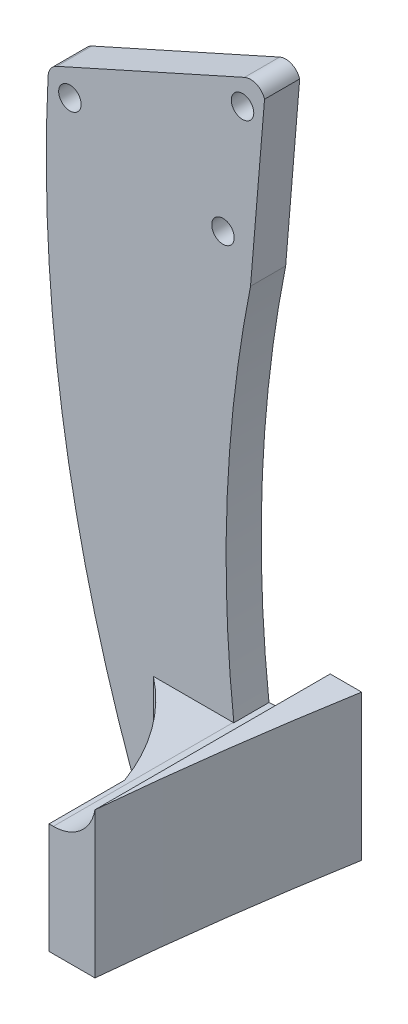
from build123d import *

# Parameters (mm, degrees)
SKETCH3_R                = 1.6
BOSS_EXTRUDE2_DEPTH      = 5
SKETCH8_W                = 6.531662429
SKETCH8_H                = 15.718756423
BOSS_EXTRUDE5_DEPTH      = 25.594989388
BOSS_EXTRUDE6_DEPTH      = 5
BOSS_EXTRUDE6_DEPTH_BACK = 15.725319597
BOSS_EXTRUDE7_DEPTH      = 15.715206985
FILLET3_R                = 6


with BuildPart() as part:
    # Sketch3 → Boss-Extrude2 (new body)
    with BuildSketch(Plane.XY):
        with BuildLine():
            Line((15.398328751, 23.358235096), (42.103650237, 35.3480109))
            ThreePointArc((42.103650237, 35.3480109), (43.812929052, 35.351800988), (44.957199874, 34.082040099))
            Line((44.957199874, 34.082040099), (42.962535727, 10.043789437))
            ThreePointArc((42.962535727, 10.043789437), (39.652134692, -17.353336053), (40.589325164, -44.933816726))
            Line((40.589325164, -44.933816726), (46.4215305, -44.933816726))
            Line((46.4215305, -44.933816726), (46.4215305, -60.652573149))
            Line((46.4215305, -60.652573149), (28.574574678, -60.652573149))
            ThreePointArc((28.574574678, -60.652573149), (27.026794649, -59.729266605), (26.047291344, -58.216424488))
            ThreePointArc((26.047291344, -58.216424488), (16.153529465, -18.922365583), (14.162802755, 21.549187347))
            ThreePointArc((14.162802755, 21.549187347), (14.525551977, 22.627878073), (15.398328751, 23.358235096))
        make_face()
        with Locations((17.26515434, 20.395199458)):
            Circle(SKETCH3_R, mode=Mode.SUBTRACT)
        with Locations((41.82515434, 31.625199458)):
            Circle(SKETCH3_R, mode=Mode.SUBTRACT)
        with Locations((39.04515434, 14.855199458)):
            Circle(SKETCH3_R, mode=Mode.SUBTRACT)
    extrude(amount=BOSS_EXTRUDE2_DEPTH)

    # Sketch8 → Boss-Extrude5 (add)
    with BuildSketch(Plane.XY.offset(5)):
        with Locations((43.155699286, -52.793194938)):
            Rectangle(SKETCH8_W, SKETCH8_H)
    extrude(amount=BOSS_EXTRUDE5_DEPTH)

    # Sketch9 → Boss-Extrude6 (add, two sides: drawn at the far end of the back side and taken through both)
    with BuildSketch(Plane(origin=(0, -44.933816726, 0), x_dir=(1, 0, 0), z_dir=(0, 1, 0)).offset(-BOSS_EXTRUDE6_DEPTH_BACK)):
        with BuildLine():
            Line((46.4215305, -30.594989388), (46.4215305, 0))
            Line((46.4215305, 0), (46.4215305, 2.879605598))
            Line((46.4215305, 2.879605598), (50.894134372, 2.879605598))
            ThreePointArc((50.894134372, 2.879605598), (48.34293367, -13.815617676), (46.4215305, -30.594989388))
        make_face()
    extrude(amount=BOSS_EXTRUDE6_DEPTH + BOSS_EXTRUDE6_DEPTH_BACK)

    # Sketch10 → Boss-Extrude7 (add)
    with BuildSketch(Plane(origin=(0, -44.933816726, 0), x_dir=(1, 0, 0), z_dir=(0, 1, 0))):
        with BuildLine():
            Line((29.146955031, -5), (41.859352304, -5))
            Line((41.859352304, -5), (41.859352304, -30.594989388))
            ThreePointArc((41.859352304, -30.594989388), (38.401030969, -16.358190815), (29.146955031, -5))
        make_face()
    extrude(amount=-BOSS_EXTRUDE7_DEPTH)

    # Fillet3
    # the kernel refuses this fillet: 6 mm, written as the material it adds along each edge
    with BuildSketch(Plane(origin=(46.4215305, -44.933816726, 30.594989388), x_dir=(0, 1, 0), z_dir=(0, 0, -1))) as fillet3_piece_1_section:
        with BuildLine():
            CenterArc((6, -5.916079783), FILLET3_R, 99.594068227, 80.405931773)
            Line((0, -5.916079783), (-0.12, -5.916079783))
            Line((-0.12, -5.916079783), (-0.12, 0))
            Line((-0.12, 0), (0, 0.12))
            ThreePointArc((0, 0.12), (2.5, 0.12), (4.98, 0.118321596))
            Line((4.98, 0.118321596), (5, 0))
        make_face()
    fillet3_piece_1 = extrude(amount=30.594989388, mode=Mode.PRIVATE)
    fillet3_piece_1 = fillet3_piece_1 - Plane(origin=(493.305440786, -43.701646152, 73.26789881), x_dir=(-0.9855086772136745, 0, -0.16962501919396705), z_dir=(0, -1, 0)) * Cylinder(448.916703265, 85, mode=Mode.PRIVATE)
    add(fillet3_piece_1)


solid = part.part
